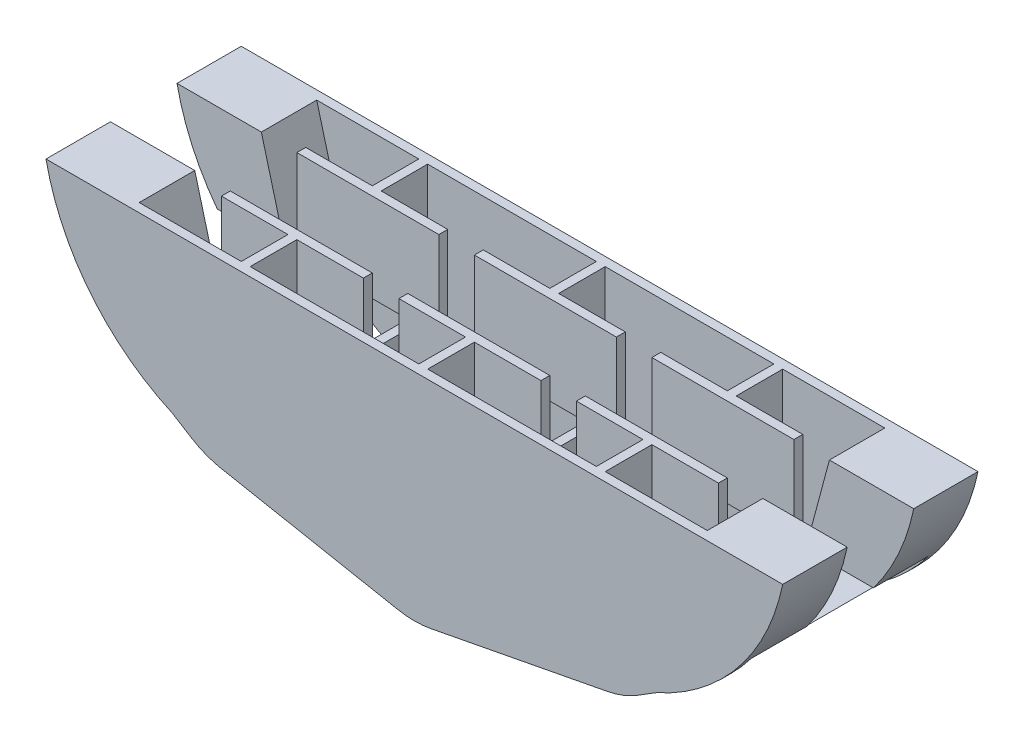
from build123d import *

# Parameters (mm, degrees)
BOSS_EXTRUDE1_DEPTH                 = 111.76
SKETCH5_W                           = 304.8
SKETCH5_H                           = 25.4
CUT_EXTRUDE3_DEPTH                  = 101.6
CUT_EXTRUDE4_DEPTH                  = 227.288199427
CUT_EXTRUDE4_DEPTH_BACK             = 227.288199427
SKETCH3_W                           = 96.52
SKETCH3_H                           = 101.6
SKETCH3_W_2                         = 48.26
CUT_EXTRUDE5_REACH                  = 288.663
SKETCH6_W                           = 38.1
SKETCH6_H                           = 50.8
SKETCH7_W                           = 81.28
SKETCH7_H                           = 50.8
BOSS_EXTRUDE2_DEPTH                 = 5.08
SKETCH9_W                           = 5.08
SKETCH9_H                           = 95.25
BOSS_EXTRUDE3_DEPTH                 = 10.16
SKETCH10_W                          = 5.08
SKETCH10_H                          = 95.206439839
BOSS_EXTRUDE4_DEPTH                 = 10.16
CUT_EXTRUDE7_REACH                  = 208.854
FILLET1_R                           = 50.8
BOSS_EXTRUDE5_REACH                 = 208.854
CUT_EXTRUDE8_REACH                  = 248.593
CUT_EXTRUDE8_END_RADIUS             = 126.32098656
CUT_EXTRUDE8_DIRECTION_2_REACH      = 248.593
CUT_EXTRUDE8_DIRECTION_2_END_RADIUS = 126.32098656


with BuildPart() as part:
    # Sketch1 → Boss-Extrude1 (new body)
    with BuildSketch(Plane.XY):
        Polygon((-152.4, 62.23), (-152.4, -33.02), (0, -62.23), (152.4, -32.976439839), (152.4, 62.23), align=None)
    extrude(amount=-BOSS_EXTRUDE1_DEPTH)

    # Sketch5 → Cut-Extrude3 (cut)
    with BuildSketch(Plane.XY.offset(-5.08)):
        with Locations((0, -1.27)):
            Rectangle(SKETCH5_W, SKETCH5_H)
    extrude(amount=-CUT_EXTRUDE3_DEPTH, mode=Mode.SUBTRACT)

    # Sketch3 → Cut-Extrude4 (cut, two sides: drawn at the far end of the back side and taken through both)
    with BuildSketch(Plane(origin=(0, 62.23, 0), x_dir=(1, 0, 0), z_dir=(0, 1, 0)).offset(-CUT_EXTRUDE4_DEPTH_BACK)):
        with Locations((-50.8, 55.88)):
            Rectangle(SKETCH3_W, SKETCH3_H)
        with Locations((50.8, 55.88)):
            Rectangle(SKETCH3_W, SKETCH3_H)
        with Locations((-128.27, 55.88)):
            Rectangle(SKETCH3_W_2, SKETCH3_H)
        with Locations((128.27, 55.88)):
            Rectangle(SKETCH3_W_2, SKETCH3_H)
    extrude(amount=CUT_EXTRUDE4_DEPTH + CUT_EXTRUDE4_DEPTH_BACK, mode=Mode.SUBTRACT)

    # Cut-Extrude5: up to this face of the body (flat: up to its plane)
    cut_extrude5_end = Plane(part.part.faces().sort_by_distance((104.14, 36.83, -55.88))[0])
    # Sketch6 → Cut-Extrude5 (cut, up to the picked face)
    with BuildSketch(Plane.ZY.offset(104.14), mode=Mode.PRIVATE) as cut_extrude5_sk1:
        with Locations((-55.932057734, 36.83)):
            Rectangle(SKETCH6_W, SKETCH6_H)
    cut_extrude5_tool1 = split(extrude(cut_extrude5_sk1.sketch, amount=-CUT_EXTRUDE5_REACH, mode=Mode.PRIVATE), bisect_by=cut_extrude5_end, keep=Keep.BOTH, mode=Mode.PRIVATE)
    add(cut_extrude5_tool1.solids().sort_by(Axis((-104.14, 36.83, -55.932058), (1, 0, 0)))[0], mode=Mode.SUBTRACT)

    # Sketch7 → Boss-Extrude2 (add)
    with BuildSketch(Plane(origin=(0, 0, -36.882057734), x_dir=(-1, 0, 0), z_dir=(0, 0, -1))):
        with Locations((0, 36.83)):
            Rectangle(SKETCH7_W, SKETCH7_H)
        with Locations((101.6, 36.83)):
            Rectangle(SKETCH7_W, SKETCH7_H)
        with Locations((-101.6, 36.83)):
            Rectangle(SKETCH7_W, SKETCH7_H)
    boss_extrude2 = extrude(amount=-BOSS_EXTRUDE2_DEPTH)

    # Mirror1: Boss-Extrude2 across plane
    add(boss_extrude2.mirror(Plane(origin=(0, 0, -55.932057734), x_dir=(1, 0, 0), z_dir=(0, 0, -1))))

    # Sketch9 → Boss-Extrude3 (add)
    with BuildSketch(Plane.ZY.offset(152.4)):
        with Locations((-109.22, 14.605)):
            Rectangle(SKETCH9_W, SKETCH9_H)
        with Locations((-2.54, 14.605)):
            Rectangle(SKETCH9_W, SKETCH9_H)
    extrude(amount=BOSS_EXTRUDE3_DEPTH)

    # Sketch10 → Boss-Extrude4 (add)
    with BuildSketch(Plane(origin=(152.4, 0, 0), x_dir=(0, 0, -1), z_dir=(1, 0, 0))):
        with Locations((2.54, 14.626780081)):
            Rectangle(SKETCH10_W, SKETCH10_H)
        with Locations((109.22, 14.626780081)):
            Rectangle(SKETCH10_W, SKETCH10_H)
    extrude(amount=BOSS_EXTRUDE4_DEPTH)

    # Cut-Extrude7: up to this face of the body (flat: up to its plane)
    cut_extrude7_end = Plane(part.part.faces().sort_by_distance((-0.011490312, 7.400814094, -111.76))[0])
    # Sketch11 → Cut-Extrude7 (cut, up to the picked face)
    with BuildSketch(Plane.XY, mode=Mode.PRIVATE) as cut_extrude7_sk1:
        Polygon((-162.56, -12.7), (-119.696308585, -39.288207521), (-152.4, -33.02), (-162.56, -33.02), align=None)
    cut_extrude7_tool1 = split(extrude(cut_extrude7_sk1.sketch, amount=-CUT_EXTRUDE7_REACH, mode=Mode.PRIVATE), bisect_by=cut_extrude7_end, keep=Keep.BOTH, mode=Mode.PRIVATE)
    # Sketch11 → Cut-Extrude7 (cut, up to the picked face)
    with BuildSketch(Plane.XY, mode=Mode.PRIVATE) as cut_extrude7_sk2:
        Polygon((152.4, -33.02), (162.56, -33.02), (162.56, -12.7), (119.696308585, -39.288207521), align=None)
    cut_extrude7_tool2 = split(extrude(cut_extrude7_sk2.sketch, amount=-CUT_EXTRUDE7_REACH, mode=Mode.PRIVATE), bisect_by=cut_extrude7_end, keep=Keep.BOTH, mode=Mode.PRIVATE)
    add(cut_extrude7_tool1.solids().sort_by(Axis((-148.539263, -27.801749, 0), (0, 0, -1)))[0], mode=Mode.SUBTRACT)
    add(cut_extrude7_tool2.solids().sort_by(Axis((148.539263, -27.801749, 0), (0, 0, -1)))[0], mode=Mode.SUBTRACT)

    # Fillet1
    # the kernel refuses this fillet: 50.8 mm, written as the material it takes off along each edge
    with BuildSketch(Plane(origin=(-162.56, -12.7, 70.671047804), x_dir=(0.8497897447130388, -0.5271217978613181, 0), z_dir=(0, 0, -1)), Plane(origin=(-162.56, -12.7, -36.008952196), x_dir=(0.8497897447130388, -0.5271217978613181, 0), z_dir=(0, 0, -1)), Plane(origin=(162.56, -12.7, 70.671047804), x_dir=(0, 1, 0), z_dir=(0, 0, -1))) as fillet1_piece_1:
        with BuildLine():
            CenterArc((FILLET1_R * 0.556464943335, -FILLET1_R), FILLET1_R, 90, 58.188808221)
            Line((-FILLET1_R * 0.293324801378, -FILLET1_R * 0.472878202139), (0, 0))
            Line((0, 0), (FILLET1_R * 0.556464943335, 0))
        make_face()
    extrude(amount=146.422095607, mode=Mode.SUBTRACT)
    with BuildSketch(Plane(origin=(-119.696308585, -39.288207521, -83.186546401), x_dir=(0.9821230119270369, -0.18824024395268216, 0), z_dir=(0, 0, -1)), Plane(origin=(-119.696308585, -39.288207521, 23.493453599), x_dir=(0.9821230119270369, -0.18824024395268216, 0), z_dir=(0, 0, -1))) as fillet1_piece_2:
        with BuildLine():
            CenterArc((FILLET1_R * 0.184987823618, -FILLET1_R), FILLET1_R, 90, 20.961087149)
            Line((-FILLET1_R * 0.172745995297, -FILLET1_R * 0.0661764005955), (0, 0))
            Line((0, 0), (FILLET1_R * 0.184987823618, 0))
        make_face()
    extrude(amount=52.066907199, mode=Mode.SUBTRACT)
    with BuildSketch(Plane(origin=(162.56, -12.7, -36.008952196), x_dir=(-0.8497897447130388, -0.5271217978613181, 0), z_dir=(0, 0, -1))) as fillet1_piece_3:
        with BuildLine():
            CenterArc((FILLET1_R * 0.556464943335, FILLET1_R), FILLET1_R, 211.811191779, 58.188808221)
            Line((-FILLET1_R * 0.293324801378, FILLET1_R * 0.472878202139), (0, 0))
            Line((0, 0), (FILLET1_R * 0.556464943335, 0))
        make_face()
    extrude(amount=146.422095607, mode=Mode.SUBTRACT)
    with BuildSketch(Plane(origin=(119.776180176, -39.238663434, 23.475348992), x_dir=(-0.9820710795721669, -0.18851099349363817, 0), z_dir=(0, 0, -1)), Plane(origin=(119.776180176, -39.238663434, -83.204651008), x_dir=(-0.9820710795721669, -0.18851099349363817, 0), z_dir=(0, 0, -1))) as fillet1_piece_4:
        with BuildLine():
            CenterArc((FILLET1_R * 0.184845267653, FILLET1_R), FILLET1_R, 249.054708445, 20.945291555)
            Line((-FILLET1_R * 0.172631096402, FILLET1_R * 0.0660778141933), (0, 0))
            Line((0, 0), (FILLET1_R * 0.184845267653, 0))
        make_face()
    extrude(amount=52.030697984, mode=Mode.SUBTRACT)
    with BuildSketch(Plane(origin=(0, -62.23, 24.359816254), x_dir=(-0.982123011927037, 0.1882402439526816, 0), z_dir=(0, 0, -1))) as fillet1_piece_5:
        with BuildLine():
            CenterArc((FILLET1_R * 0.191809576801, FILLET1_R), FILLET1_R, 248.283995147, 21.716004853)
            Line((-FILLET1_R * 0.178196707507, FILLET1_R * 0.0709707488072), (0, 0))
            Line((0, 0), (FILLET1_R * 0.191809576801, 0))
        make_face()
    extrude(amount=160.479632508, mode=Mode.SUBTRACT)

    # Boss-Extrude5: up to this face of the body (flat: up to its plane)
    boss_extrude5_end = Plane(part.part.faces().sort_by_distance((-0.004732582, 8.379000895, -111.76))[0])
    # Sketch12 → Boss-Extrude5 (add, up to the picked face)
    with BuildSketch(Plane.XY, mode=Mode.PRIVATE) as boss_extrude5_sk1:
        with BuildLine():
            Line((-162.56, 62.23), (-210.82, 62.23))
            ThreePointArc((-210.82, 62.23), (-185.525923559, 8.586514121), (-138.537787331, -27.60089991))
            Line((-138.537787331, -27.60089991), (-162.56, 62.23))
        make_face()
    boss_extrude5_tool1 = split(extrude(boss_extrude5_sk1.sketch, amount=-BOSS_EXTRUDE5_REACH, mode=Mode.PRIVATE), bisect_by=boss_extrude5_end, keep=Keep.BOTH, mode=Mode.PRIVATE)
    # Sketch12 → Boss-Extrude5 (add, up to the picked face)
    with BuildSketch(Plane.XY, mode=Mode.PRIVATE) as boss_extrude5_sk2:
        with BuildLine():
            Line((162.56, 62.23), (210.82, 62.23))
            ThreePointArc((210.82, 62.23), (185.525923559, 8.586514121), (138.537787331, -27.60089991))
            Line((138.537787331, -27.60089991), (162.56, 62.23))
        make_face()
    boss_extrude5_tool2 = split(extrude(boss_extrude5_sk2.sketch, amount=-BOSS_EXTRUDE5_REACH, mode=Mode.PRIVATE), bisect_by=boss_extrude5_end, keep=Keep.BOTH, mode=Mode.PRIVATE)
    add(boss_extrude5_tool1.solids().sort_by(Axis((-173.436994, 26.131053, 0), (0, 0, -1)))[0])
    add(boss_extrude5_tool2.solids().sort_by(Axis((173.436994, 26.131053, 0), (0, 0, -1)))[0])

    # Cut-Extrude8: up to this cylinder (the profile starts inside it)
    cut_extrude8_end = Plane(origin=(-87.109319049, 87.777192878, -55.90231), z_dir=(0, 0, 1)) * Cylinder(CUT_EXTRUDE8_END_RADIUS, 750.827973119, mode=Mode.PRIVATE)
    # Sketch13 → Cut-Extrude8 (cut, up to the surface)
    with BuildSketch(Plane(origin=(0, 0, 0), x_dir=(0, 0, -1), z_dir=(1, 0, 0)), mode=Mode.PRIVATE) as cut_extrude8_sk1:
        Polygon((36.882057734, 62.23), (36.882057734, 11.43), (5.08, 11.43), (5.08, -13.97), (106.68, -13.97), (106.68, 11.43), (74.982057734, 11.43), (74.982057734, 62.23), align=None)
    cut_extrude8_tool1 = extrude(cut_extrude8_sk1.sketch, amount=-CUT_EXTRUDE8_REACH, mode=Mode.PRIVATE) & cut_extrude8_end
    add(cut_extrude8_tool1.solids().sort_by_distance((0, 15.058571, -55.90231))[0], mode=Mode.SUBTRACT)

    # Cut-Extrude8 direction 2: up to this cylinder (the profile starts inside it)
    cut_extrude8_direction_2_end = Plane(origin=(87.109319049, 87.777192878, -55.90231), z_dir=(0, 0, 1)) * Cylinder(CUT_EXTRUDE8_DIRECTION_2_END_RADIUS, 750.827973119, mode=Mode.PRIVATE)
    # Sketch13 → Cut-Extrude8 direction 2 (cut, up to the surface)
    with BuildSketch(Plane(origin=(0, 0, 0), x_dir=(0, 0, -1), z_dir=(1, 0, 0)), mode=Mode.PRIVATE) as cut_extrude8_direction_2_sk1:
        Polygon((36.882057734, 62.23), (36.882057734, 11.43), (5.08, 11.43), (5.08, -13.97), (106.68, -13.97), (106.68, 11.43), (74.982057734, 11.43), (74.982057734, 62.23), align=None)
    cut_extrude8_direction_2_tool1 = extrude(cut_extrude8_direction_2_sk1.sketch, amount=CUT_EXTRUDE8_DIRECTION_2_REACH, mode=Mode.PRIVATE) & cut_extrude8_direction_2_end
    add(cut_extrude8_direction_2_tool1.solids().sort_by_distance((0, 15.058571, -55.90231))[0], mode=Mode.SUBTRACT)


solid = part.part
